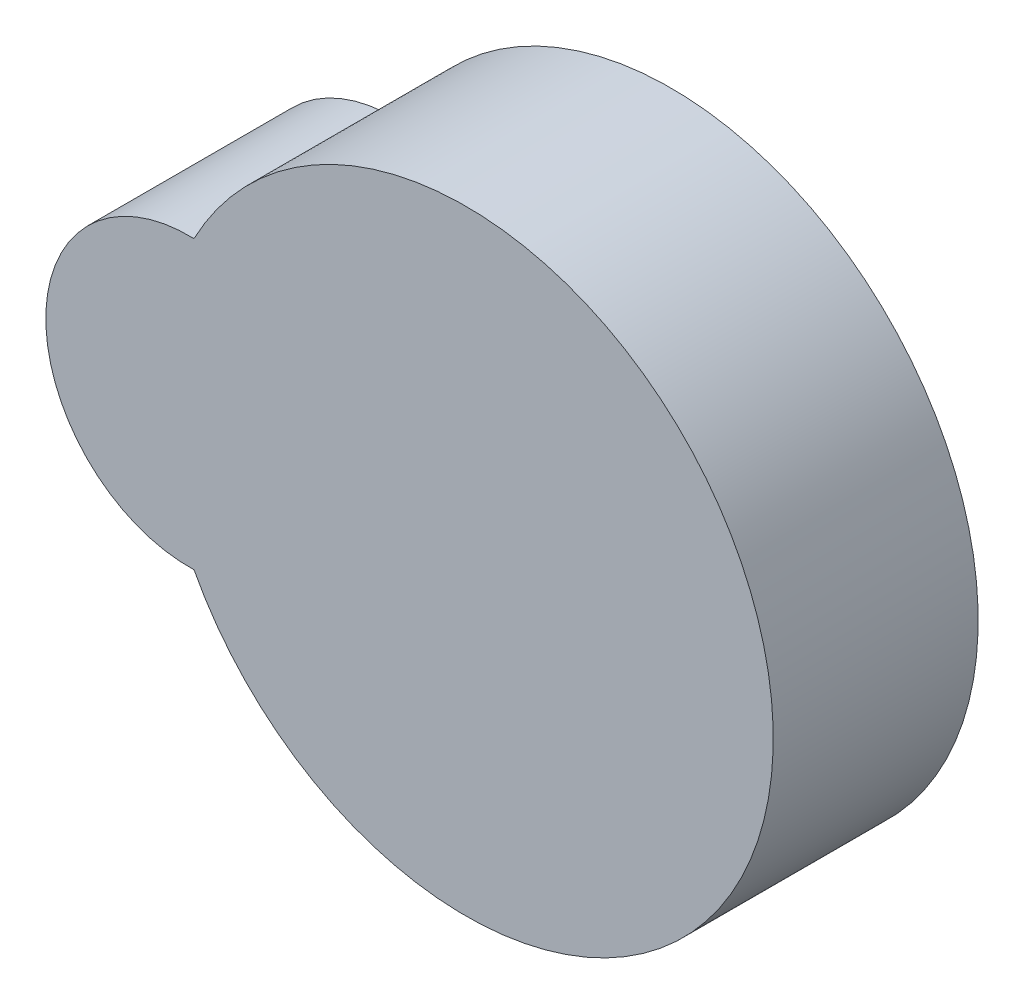
from build123d import *

# Parameters (mm, degrees)
SKETCH_1_R      = 15
SKETCH_1_R_2    = 7
EXTRUDE_1_DEPTH = 10


with BuildPart() as part:
    # ｽｹｯﾁ1 → ﾎﾞｽ - 押し出し1 (new body)
    with BuildSketch(Plane.XY):
        Circle(SKETCH_1_R)
        with Locations((-13.5, 0)):
            Circle(SKETCH_1_R_2)
    extrude(amount=EXTRUDE_1_DEPTH)


solid = part.part
